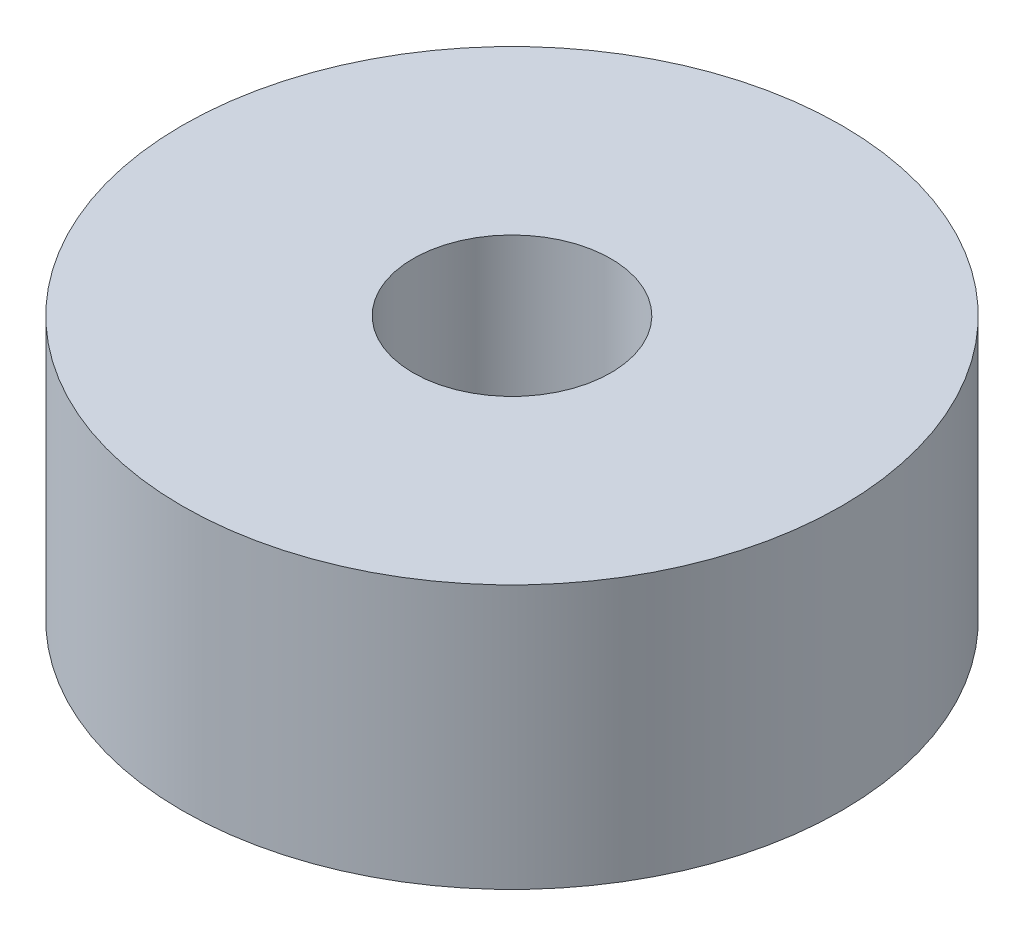
from build123d import *

# Parameters (mm, degrees)
SKETCH1_R           = 5
SKETCH1_R_2         = 1.5
BOSS_EXTRUDE1_DEPTH = 2


with BuildPart() as part:
    # Sketch1 → Boss-Extrude1 (new, symmetric)
    with BuildSketch(Plane(origin=(0, 0, 0), x_dir=(1, 0, 0), z_dir=(0, 1, 0))):
        Circle(SKETCH1_R)
        Circle(SKETCH1_R_2, mode=Mode.SUBTRACT)
    extrude(amount=BOSS_EXTRUDE1_DEPTH, both=True)


solid = part.part
